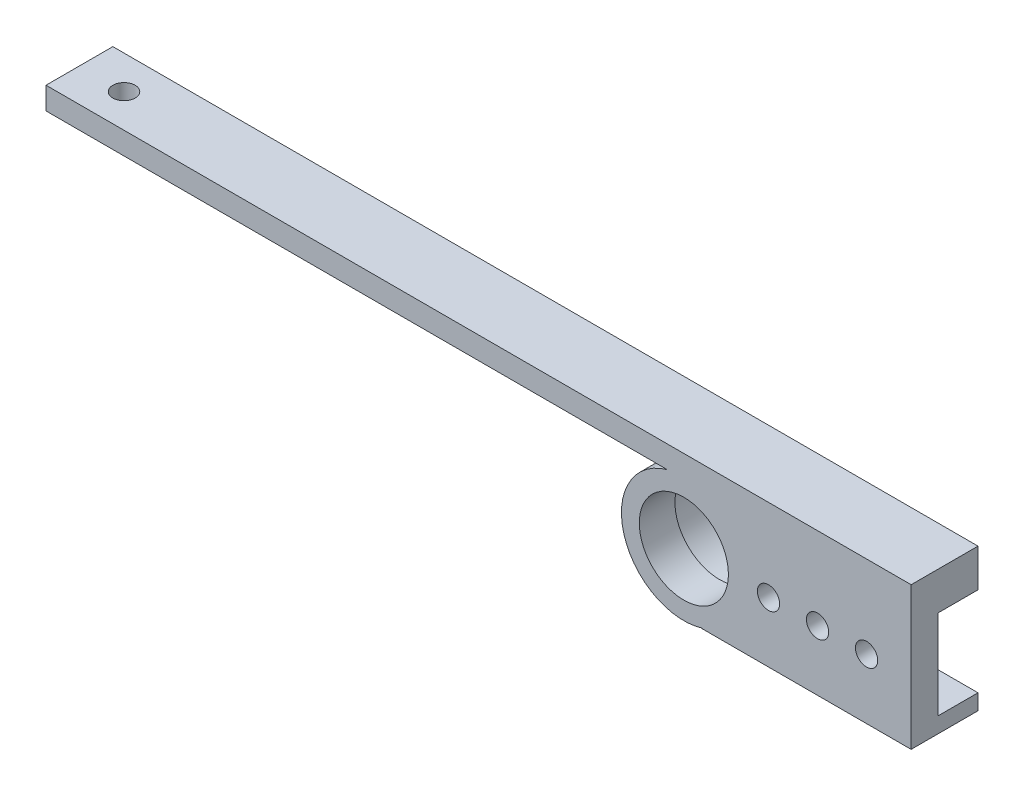
from build123d import *

# Parameters (mm, degrees)
SKETCH_1_W          = 40
SKETCH_1_H          = 20
EXTRUDE_1_DEPTH     = 6
SKETCH_2_R          = 2.5
CUT_EXTRUDE_1_DEPTH = 24.151673806
EXTRUDE_START       = -15
EXTRUDE_2_OUTLINE_R = 11
EXTRUDE_2_DEPTH     = 15
EXTRUDE_START_2     = -8
SKETCH_5_R          = 11
SKETCH_5_R_2        = 10
EXTRUDE_3_DEPTH     = 8
SKETCH_8_W          = 15
SKETCH_8_H          = 5
EXTRUDE_4_DEPTH     = 200
SKETCH_9_W          = 4.403653586
SKETCH_9_H          = 3.736433346
EXTRUDE_5_DEPTH     = 15
SKETCH_13_W         = 64.67728996
SKETCH_13_H         = 18.524474632
CUT_EXTRUDE_2_DEPTH = 184.131783151
SKETCH_15_W         = 55.676477601
SKETCH_15_H         = 15
EXTRUDE_6_DEPTH     = 5
SKETCH_16_R         = 2.5
CUT_EXTRUDE_3_DEPTH = 10


# Read off the part's stored shape, not the designer's step: 凸台-拉伸2
with BuildPart() as part:
    # 草图1 → 凸台-拉伸1 (new body)
    with BuildSketch(Plane.XY):
        Rectangle(SKETCH_1_W, SKETCH_1_H)
    extrude(amount=EXTRUDE_1_DEPTH)

    # 草图2 → 切除-拉伸1 (cut, through all)
    with BuildSketch(Plane.XY.offset(6)):
        with Locations((10, 0)):
            Circle(SKETCH_2_R)
        with Locations((-1, 0)):
            Circle(SKETCH_2_R)
        with Locations((-12, 0)):
            Circle(SKETCH_2_R)
    extrude(amount=-CUT_EXTRUDE_1_DEPTH, mode=Mode.SUBTRACT)

    # 凸台-拉伸2 outline → 凸台-拉伸2 (add)
    with BuildSketch(Plane.XY.offset(6).offset(EXTRUDE_START)):
        with BuildLine():
            Line((20, 10), (20, 13.5))
            Line((20, 13.5), (-26.893967141, 13.5))
            Line((-26.893967141, 13.5), (-26.893967141, 13.384337644))
            ThreePointArc((-26.893967141, 13.384337644), (-45, 0), (-26.893967141, -13.384337644))
            Line((-26.893967141, -13.384337644), (-26.893967141, -13.5))
            Line((-26.893967141, -13.5), (20, -13.5))
            Line((20, -13.5), (20, -10))
            Line((20, -10), (-20, -10))
            Line((-20, -10), (-20, -8.660254038))
            ThreePointArc((-20, -8.660254038), (-17, 0), (-20, 8.660254038))
            Line((-20, 8.660254038), (-20, 10))
            Line((-20, 10), (20, 10))
        make_face()
        with Locations((-31, 0)):
            Circle(EXTRUDE_2_OUTLINE_R, mode=Mode.SUBTRACT)
    extrude(amount=EXTRUDE_2_DEPTH)

    # 草图5 → 凸台-拉伸3 (add)
    with BuildSketch(Plane.XY.offset(6).offset(EXTRUDE_START_2)):
        with Locations((-31, 0)):
            Circle(SKETCH_5_R)
        with Locations((-31, 0)):
            Circle(SKETCH_5_R_2, mode=Mode.SUBTRACT)
    extrude(amount=EXTRUDE_3_DEPTH)

    # 草图8 → 凸台-拉伸4 (add)
    with BuildSketch(Plane(origin=(20, 0, 0), x_dir=(0, 0, -1), z_dir=(1, 0, 0))):
        with Locations((1.5, 16)):
            Rectangle(SKETCH_8_W, SKETCH_8_H)
    extrude(amount=-EXTRUDE_4_DEPTH)

    # 草图9 → 凸台-拉伸5 (add, through all)
    with BuildSketch(Plane.XY.offset(6)):
        with Locations((-27.364497847, 13.796597935)):
            Rectangle(SKETCH_9_W, SKETCH_9_H)
    extrude(amount=-EXTRUDE_5_DEPTH)

    # 草图13 → 切除-拉伸2 (cut, through all)
    with BuildSketch(Plane(origin=(0, 18.5, 0), x_dir=(1, 0, 0), z_dir=(0, 1, 0))):
        with Locations((-150.772464122, 3.262237316)):
            Rectangle(SKETCH_13_W, SKETCH_13_H)
    extrude(amount=-CUT_EXTRUDE_2_DEPTH, mode=Mode.SUBTRACT)

    # 草图15 → 凸台-拉伸6 (add)
    with BuildSketch(Plane(origin=(0, 18.5, 0), x_dir=(1, 0, 0), z_dir=(0, 1, 0))):
        with Locations((-146.272057942, 1.5)):
            Rectangle(SKETCH_15_W, SKETCH_15_H)
    extrude(amount=-EXTRUDE_6_DEPTH)

    # 草图16 → 切除-拉伸3 (cut)
    with BuildSketch(Plane(origin=(0, 18.5, 0), x_dir=(1, 0, 0), z_dir=(0, 1, 0))):
        with Locations(Location((-164.110296743, 1.5, 0), (0, 0, 270))):
            Circle(SKETCH_16_R)
    extrude(amount=-CUT_EXTRUDE_3_DEPTH, mode=Mode.SUBTRACT)


solid = part.part
